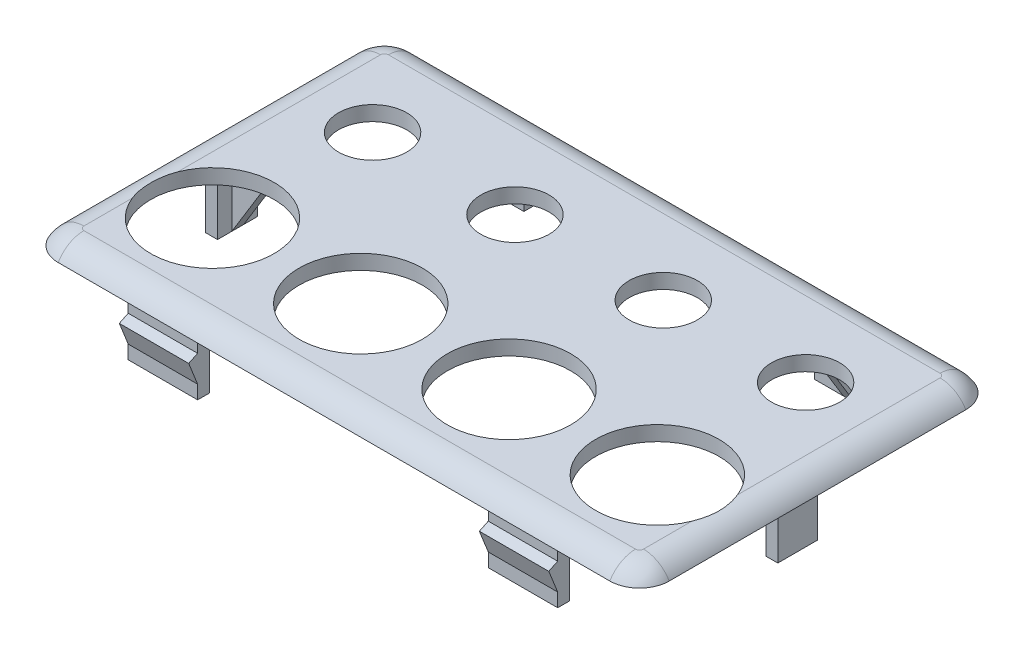
from build123d import *

# Parameters (mm, degrees)
BOSS_EXTRUDE1_DEPTH     = 2.5
FILLET1_R               = 5
BOSS_EXTRUDE2_DEPTH     = 9.8
CUT_EXTRUDE1_DEPTH      = 9.8
CUT_EXTRUDE2_DEPTH      = 89.657557489
BOSS_EXTRUDE3_DEPTH     = 11.7
MIRROR4_COPY_1_DEPTH    = 11.7
CUT_EXTRUDE3_DEPTH      = 61.401076149
CUT_EXTRUDE3_DEPTH_BACK = 61.401076149
SKETCH7_R               = 10.4
SKETCH7_R_2             = 5.75


with BuildPart() as part:
    # Sketch1 → Boss-Extrude1 (new body)
    with BuildSketch(Plane(origin=(0, 0, 0), x_dir=(1, 0, 0), z_dir=(0, 1, 0))):
        with BuildLine():
            Line((-46.5, 30), (46.5, 30))
            ThreePointArc((46.5, 30), (50.035533906, 28.535533906), (51.5, 25))
            Line((51.5, 25), (51.5, -25))
            ThreePointArc((51.5, -25), (50.035533906, -28.535533906), (46.5, -30))
            Line((46.5, -30), (-46.5, -30))
            ThreePointArc((-46.5, -30), (-50.035533906, -28.535533906), (-51.5, -25))
            Line((-51.5, -25), (-51.5, 25))
            ThreePointArc((-51.5, 25), (-50.035533906, 28.535533906), (-46.5, 30))
        make_face()
    extrude(amount=BOSS_EXTRUDE1_DEPTH)

    # Fillet1
    # the kernel refuses this fillet: 5 mm, written as the material it takes off along each edge
    with BuildSketch(Plane(origin=(-46.5, 2.5, -25), x_dir=(-1, 0, 0), z_dir=(0, 0, 1))) as fillet1_piece_1:
        with BuildLine():
            CenterArc((0.669872981, 5), FILLET1_R, 270, 60)
            Line((0.669872981, 0), (0.669872981, -0.1))
            Line((0.669872981, -0.1), (5, -0.1))
            Line((5, -0.1), (5.1, 0))
            ThreePointArc((5.1, 0), (5.1, 1.25), (5.08660254, 2.45))
            Line((5.08660254, 2.45), (5, 2.5))
        make_face()
    revolve(axis=Axis((-46.5, 2.5, -25), (0, -1, 0)), revolution_arc=90, mode=Mode.SUBTRACT)
    with BuildSketch(Plane(origin=(-46.5, 2.5, -30), x_dir=(0, -1, 0), z_dir=(1, 0, 0)), Plane(origin=(46.5, 2.5, 30), x_dir=(0, -1, 0), z_dir=(-1, 0, 0))) as fillet1_piece_2:
        with BuildLine():
            CenterArc((5, -4.330127019), FILLET1_R, 120, 60)
            Line((0, -4.330127019), (-0.1, -4.330127019))
            Line((-0.1, -4.330127019), (-0.1, 0))
            Line((-0.1, 0), (0, 0.1))
            ThreePointArc((0, 0.1), (1.25, 0.1), (2.45, 0.08660254))
            Line((2.45, 0.08660254), (2.5, 0))
        make_face()
    extrude(amount=93, mode=Mode.SUBTRACT)
    with BuildSketch(Plane(origin=(46.5, 2.5, -25), x_dir=(0, 0, -1), z_dir=(-1, 0, 0))) as fillet1_piece_3:
        with BuildLine():
            CenterArc((0.669872981, 5), FILLET1_R, 270, 60)
            Line((0.669872981, 0), (0.669872981, -0.1))
            Line((0.669872981, -0.1), (5, -0.1))
            Line((5, -0.1), (5.1, 0))
            ThreePointArc((5.1, 0), (5.1, 1.25), (5.08660254, 2.45))
            Line((5.08660254, 2.45), (5, 2.5))
        make_face()
    revolve(axis=Axis((46.5, 2.5, -25), (0, -1, 0)), revolution_arc=90, mode=Mode.SUBTRACT)
    with BuildSketch(Plane(origin=(51.5, 2.5, -25), x_dir=(0, -1, 0), z_dir=(0, 0, 1)), Plane(origin=(-51.5, 2.5, 25), x_dir=(0, -1, 0), z_dir=(0, 0, -1))) as fillet1_piece_4:
        with BuildLine():
            CenterArc((5, -4.330127019), FILLET1_R, 120, 60)
            Line((0, -4.330127019), (-0.1, -4.330127019))
            Line((-0.1, -4.330127019), (-0.1, 0))
            Line((-0.1, 0), (0, 0.1))
            ThreePointArc((0, 0.1), (1.25, 0.1), (2.45, 0.08660254))
            Line((2.45, 0.08660254), (2.5, 0))
        make_face()
    extrude(amount=50, mode=Mode.SUBTRACT)
    with BuildSketch(Plane(origin=(46.5, 2.5, 25), x_dir=(1, 0, 0), z_dir=(0, 0, -1))) as fillet1_piece_5:
        with BuildLine():
            CenterArc((0.669872981, 5), FILLET1_R, 270, 60)
            Line((0.669872981, 0), (0.669872981, -0.1))
            Line((0.669872981, -0.1), (5, -0.1))
            Line((5, -0.1), (5.1, 0))
            ThreePointArc((5.1, 0), (5.1, 1.25), (5.08660254, 2.45))
            Line((5.08660254, 2.45), (5, 2.5))
        make_face()
    revolve(axis=Axis((46.5, 2.5, 25), (0, -1, 0)), revolution_arc=90, mode=Mode.SUBTRACT)
    with BuildSketch(Plane(origin=(-46.5, 2.5, 25), x_dir=(0, 0, 1), z_dir=(1, 0, 0))) as fillet1_piece_6:
        with BuildLine():
            CenterArc((0.669872981, 5), FILLET1_R, 270, 60)
            Line((0.669872981, 0), (0.669872981, -0.1))
            Line((0.669872981, -0.1), (5, -0.1))
            Line((5, -0.1), (5.1, 0))
            ThreePointArc((5.1, 0), (5.1, 1.25), (5.08660254, 2.45))
            Line((5.08660254, 2.45), (5, 2.5))
        make_face()
    revolve(axis=Axis((-46.5, 2.5, 25), (0, -1, 0)), revolution_arc=90, mode=Mode.SUBTRACT)

    # Sketch2 → Boss-Extrude2 (add)
    with BuildSketch(Plane.XZ):
        Polygon((-36.2, 28.5), (-24.5, 28.5), (-24.5, 26.5), (-29.35, 26.5), (-29.35, 20.5), (-31.35, 20.5), (-31.35, 26.5), (-36.2, 26.5), align=None)
        Polygon((48.225, -3.282847821), (46.225, -3.282847821), (46.225, -0.999790058), (40.225, -0.999790058), (40.225, 1), (46.225, 1), (46.225, 3.417152179), (48.225, 3.417152179), align=None)
        Polygon((24.5, 28.5), (36.2, 28.5), (36.2, 26.5), (31.35, 26.5), (31.35, 20.5), (29.35, 20.5), (29.35, 26.5), (24.5, 26.5), align=None)
        Polygon((24.5, -26.5), (29.35, -26.5), (29.35, -20.5), (31.35, -20.5), (31.35, -26.5), (36.2, -26.5), (36.2, -28.5), (24.5, -28.5), align=None)
        Polygon((-36.2, -28.5), (-24.5, -28.5), (-24.5, -26.5), (-29.35, -26.5), (-29.35, -20.5), (-31.35, -20.5), (-31.35, -26.5), (-36.2, -26.5), align=None)
        Polygon((-48.225, 3.417152179), (-46.225, 3.417152179), (-46.225, 1), (-40.225, 1), (-40.225, -0.999790058), (-46.225, -0.999790058), (-46.225, -3.282847821), (-48.225, -3.282847821), align=None)
    extrude(amount=BOSS_EXTRUDE2_DEPTH)

    # Sketch4 → Cut-Extrude1 (cut)
    with BuildSketch(Plane(origin=(0, 0, -0.999790058), x_dir=(-1, 0, 0), z_dir=(0, 0, -1))):
        Polygon((40.225, 0), (46.225, -9.8), (40.225, -9.8), align=None)
    cut_extrude1 = extrude(amount=-CUT_EXTRUDE1_DEPTH, mode=Mode.SUBTRACT)

    # Mirror1: Cut-Extrude1 across plane
    add(cut_extrude1.mirror(Plane(origin=(0, 0, 0), x_dir=(0, 0, 1), z_dir=(1, 0, 0))), mode=Mode.SUBTRACT)

    # Sketch5 → Cut-Extrude2 (cut, through all)
    with BuildSketch(Plane.ZY.offset(31.35)):
        Polygon((-26.5, -9.8), (-20.5, 0), (-20.5, -9.8), align=None)
    cut_extrude2 = extrude(amount=-CUT_EXTRUDE2_DEPTH, mode=Mode.SUBTRACT)

    # Mirror2: Cut-Extrude2 across plane
    add(cut_extrude2.mirror(Plane.XY), mode=Mode.SUBTRACT)

    # Sketch6 → Boss-Extrude3 (add)
    with BuildSketch(Plane(origin=(36.2, 0, 0), x_dir=(0, 0, -1), z_dir=(1, 0, 0))):
        Polygon((-28.5, -3), (-28.5, -7.5), (-30, -3.726144837), align=None)
    boss_extrude3 = extrude(amount=-BOSS_EXTRUDE3_DEPTH)

    # Mirror3: Boss-Extrude3 across plane
    add(boss_extrude3.mirror(Plane(origin=(0, 0, 0), x_dir=(0, 0, 1), z_dir=(1, 0, 0))))

    # Mirror4: Boss-Extrude3 across plane
    add(boss_extrude3.mirror(Plane.XY))

    # Mirror4 copy 1 sketch → Mirror4 copy 1 (add)
    with BuildSketch(Plane.ZY.offset(36.2)):
        Polygon((-28.5, -3), (-28.5, -7.5), (-30, -3.726144837), align=None)
    extrude(amount=-MIRROR4_COPY_1_DEPTH)

    # Sketch7 → Cut-Extrude3 (cut, two sides: drawn at the far end of the back side and taken through both)
    with BuildSketch(Plane.XZ.offset(-CUT_EXTRUDE3_DEPTH_BACK)):
        with Locations(Location((-37.5, 13, 0), (0, 0, 201.597043682))):
            Circle(SKETCH7_R)
        with Locations(Location((-12.5, 13, 0), (0, 0, 270))):
            Circle(SKETCH7_R)
        with Locations(Location((-36.5, -13, 0), (0, 0, 270))):
            Circle(SKETCH7_R_2)
        with Locations(Location((12.5, 13, 0), (0, 0, 270))):
            Circle(SKETCH7_R)
        with Locations(Location((37.5, 13, 0), (0, 0, 338.402956318))):
            Circle(SKETCH7_R)
        with Locations(Location((-12.5, -13, 0), (0, 0, 270))):
            Circle(SKETCH7_R_2)
        with Locations(Location((12.5, -13, 0), (0, 0, 90))):
            Circle(SKETCH7_R_2)
        with Locations(Location((36.5, -13, 0), (0, 0, 90))):
            Circle(SKETCH7_R_2)
    extrude(amount=CUT_EXTRUDE3_DEPTH + CUT_EXTRUDE3_DEPTH_BACK, mode=Mode.SUBTRACT)


solid = part.part
